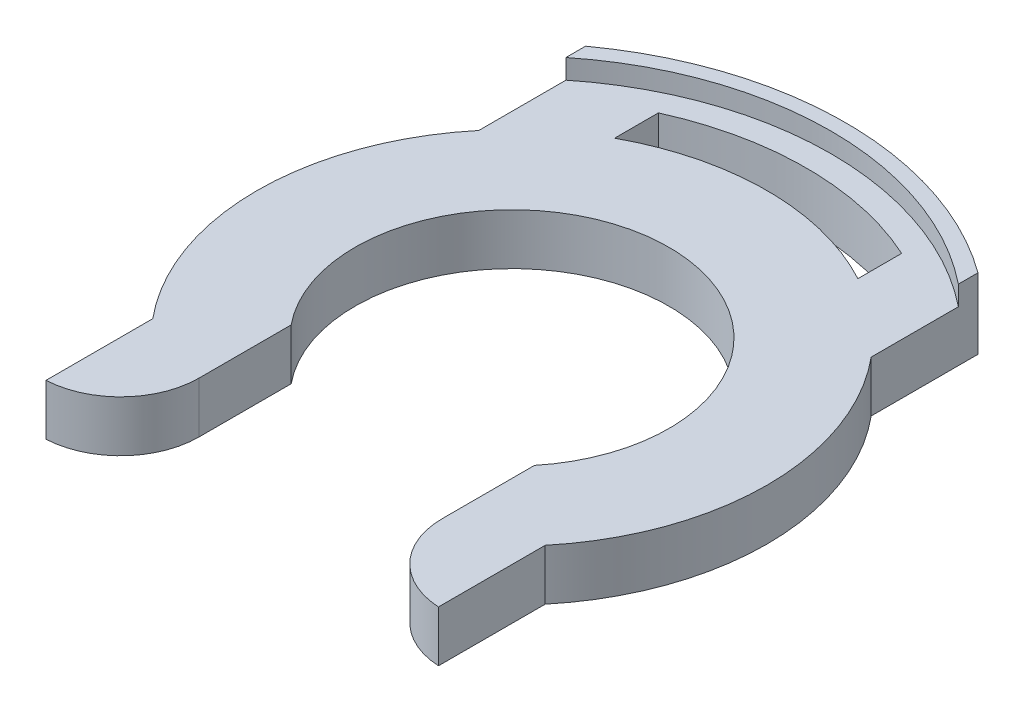
from build123d import *

# Parameters (mm, degrees)
BOSS_EXTRUDE1_DEPTH = 1.3
FILLET1_R           = 2
BOSS_EXTRUDE2_DEPTH = 0.5


with BuildPart() as part:
    # Sketch1 → Boss-Extrude1 (new body)
    with BuildSketch(Plane(origin=(0, 0, 0), x_dir=(1, 0, 0), z_dir=(0, 1, 0))):
        with BuildLine():
            ThreePointArc((-34.363462402, 3.807782606), (-31.263462402, 10.335627538), (-28.163462402, 3.807782606))
            Line((-28.163462402, 3.807782606), (-28.163462402, -1.578916037))
            ThreePointArc((-28.163462402, -1.578916037), (-27.18017283, -1.119353768), (-26.263462402, -0.538236004))
            Line((-26.263462402, -0.538236004), (-26.263462402, 2.182315607))
            ThreePointArc((-26.263462402, 2.182315607), (-24.763462402, 6.335627538), (-26.263462402, 10.488939469))
            Line((-26.263462402, 10.488939469), (-26.263462402, 13.20949108))
            ThreePointArc((-26.263462402, 13.20949108), (-31.263462402, 14.835627538), (-36.263462402, 13.20949108))
            Line((-36.263462402, 13.20949108), (-36.263462402, 10.488939469))
            ThreePointArc((-36.263462402, 10.488939469), (-37.763462402, 6.335627538), (-36.263462402, 2.182315607))
            Line((-36.263462402, 2.182315607), (-36.263462402, -0.538236004))
            ThreePointArc((-36.263462402, -0.538236004), (-35.346751974, -1.119353768), (-34.363462402, -1.578916037))
            Line((-34.363462402, -1.578916037), (-34.363462402, 3.807782606))
        make_face()
        with BuildLine():
            Line((-28.163462402, 13.16497597), (-28.163462402, 12.048770281))
            ThreePointArc((-28.163462402, 12.048770281), (-31.263462402, 12.835627538), (-34.363462402, 12.048770281))
            Line((-34.363462402, 12.048770281), (-34.363462402, 13.16497597))
            ThreePointArc((-34.363462402, 13.16497597), (-31.263462402, 13.835627538), (-28.163462402, 13.16497597))
        make_face(mode=Mode.SUBTRACT)
    extrude(amount=BOSS_EXTRUDE1_DEPTH)

    # Fillet1
    # the kernel refuses this fillet: 2 mm, written as the material it takes off along each edge
    with BuildSketch(Plane(origin=(-34.363462402, -7.59544617, 1.578916037), x_dir=(-0.877056624193214, 0, -0.4803870085241726), z_dir=(0, 1, 0))) as fillet1_piece_1:
        with BuildLine():
            CenterArc((3.213614714, -1.703880534), FILLET1_R, 121.576665182, 87.134016017)
            Line((1.459501466, -2.664654551), (1.424419201, -2.683870031))
            Line((1.424419201, -2.683870031), (-0.035082265, -0.01921548))
            Line((-0.035082265, -0.01921548), (-0.005097263, 0.039673895))
            ThreePointArc((-0.005097263, 0.039673895), (1.083168377, 0.109297404), (2.145391194, 0.034077611))
            Line((2.145391194, 0.034077611), (2.166336754, 0))
        make_face()
    extrude(amount=16.49089234, mode=Mode.SUBTRACT)
    with BuildSketch(Plane(origin=(-28.163462402, -7.59544617, 1.578916037), x_dir=(0, 0, -1), z_dir=(0, 1, 0))) as fillet1_piece_2:
        with BuildLine():
            CenterArc((3.038178468, -2), FILLET1_R, 90, 87.134016017)
            Line((1.040680033, -1.9), (1.000730064, -1.898))
            ThreePointArc((1.000730064, -1.898), (0.424480004, -1.002505053), (-0.037244911, -0.014588235))
            Line((-0.037244911, -0.014588235), (0, 0.04))
            Line((0, 0.04), (3.038178468, 0.04))
            Line((3.038178468, 0.04), (3.038178468, 0))
        make_face()
    extrude(amount=16.49089234, mode=Mode.SUBTRACT)

    # Sketch2 → Boss-Extrude2 (add)
    with BuildSketch(Plane(origin=(0, 1.3, 0), x_dir=(1, 0, 0), z_dir=(0, 1, 0))):
        with BuildLine():
            Line((-26.263462402, 12.70949108), (-26.263462402, 13.20949108))
            ThreePointArc((-26.263462402, 13.20949108), (-31.263462402, 14.835627538), (-36.263462402, 13.20949108))
            Line((-36.263462402, 13.20949108), (-36.263462402, 12.70949108))
            ThreePointArc((-36.263462402, 12.70949108), (-31.263462402, 14.464493082), (-26.263462402, 12.70949108))
        make_face()
    extrude(amount=BOSS_EXTRUDE2_DEPTH)


solid = part.part
